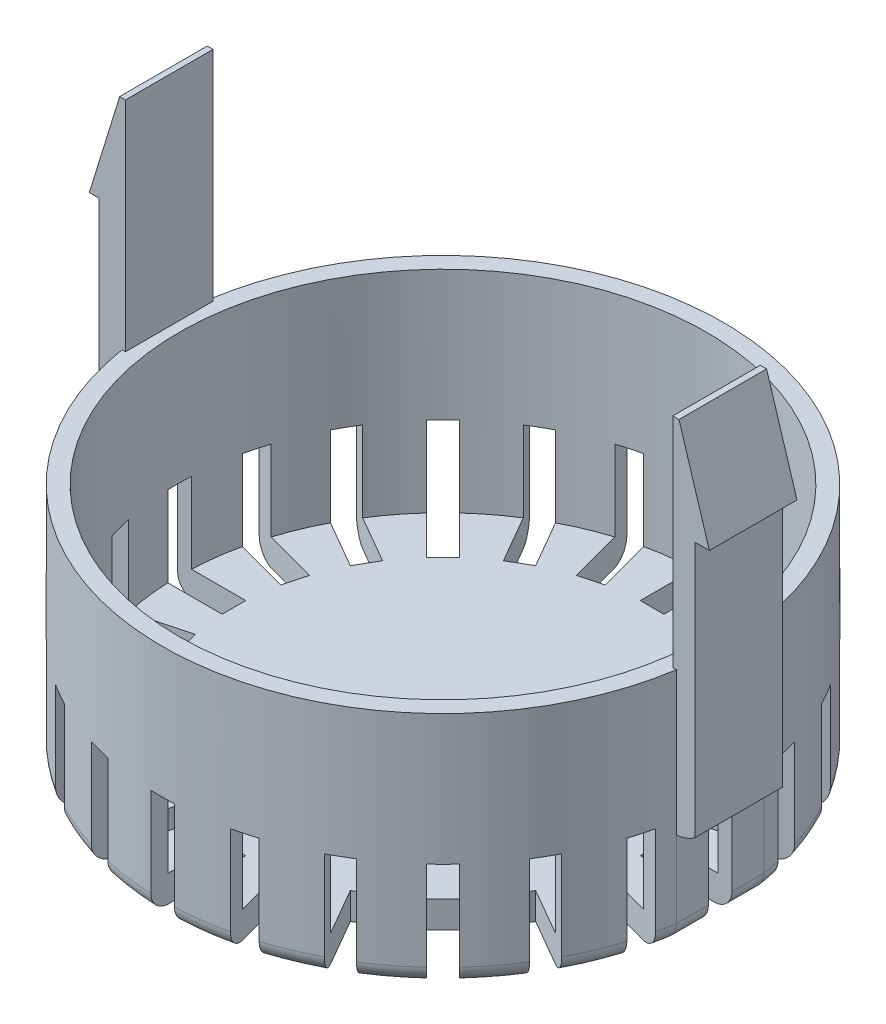
from build123d import *

# Parameters (mm, degrees)
SKETCH1_R           = 31.39
BOSS_EXTRUDE1_DEPTH = 26.6
SKETCH2_R           = 29.5
CUT_EXTRUDE1_DEPTH  = 23.6
BOSS_EXTRUDE2_DEPTH = 51
SKETCH5_W           = 3.660746386
SKETCH5_H           = 9.79976352
CUT_EXTRUDE2_DEPTH  = 10.6
SKETCH6_W           = 3.694805274
SKETCH6_H           = 9.8
CUT_EXTRUDE3_DEPTH  = 10.6
SKETCH7_W           = 2.64
SKETCH7_H           = 16
CUT_EXTRUDE4_DEPTH  = 12
CIRPATTERN1_COUNT   = 24
SKETCH8_W           = 2.64
SKETCH8_H           = 1.4
BOSS_EXTRUDE3_DEPTH = 2
SKETCH9_W           = 2.64
SKETCH9_H           = 1.4
BOSS_EXTRUDE4_DEPTH = 3.660746386
FILLET1_START       = -6
FILLET1_DEPTH       = 12
CUT_EXTRUDE6_DEPTH  = 72.568527301
CUT_EXTRUDE7_DEPTH  = 72.568527301
CUT_EXTRUDE8_DEPTH  = 72.568467345
CUT_EXTRUDE9_DEPTH  = 72.568467345
FILLET2_R           = 2
FILLET3_R           = 2


with BuildPart() as part:
    # Sketch1 → Boss-Extrude1 (new body)
    with BuildSketch(Plane(origin=(0, 0, 0), x_dir=(1, 0, 0), z_dir=(0, 1, 0))):
        with Locations(Location((0, 0, 0), (0, 0, 270))):
            Circle(SKETCH1_R)
    extrude(amount=BOSS_EXTRUDE1_DEPTH)

    # Sketch2 → Cut-Extrude1 (cut)
    with BuildSketch(Plane(origin=(0, 26.6, 0), x_dir=(1, 0, 0), z_dir=(0, 1, 0))):
        with Locations(Location((0, 0, 0), (0, 0, 270))):
            Circle(SKETCH2_R)
    extrude(amount=-CUT_EXTRUDE1_DEPTH, mode=Mode.SUBTRACT)

    # Sketch4 → Boss-Extrude2 (add)
    with BuildSketch(Plane.XZ):
        Polygon((-31.334040202, 4.89988176), (-34.665959798, 4.89988176), (-34.665959798, -4.89988176), (-31.265959798, -4.89988176), (-30.620686589, -4.89988176), (-30.620686589, 4.89988176), align=None)
        Polygon((31.3, -4.9), (34.7, -4.9), (34.7, 4.9), (31.3, 4.9), (30.602692971, 4.9), (30.602692971, -4.9), align=None)
    extrude(amount=-BOSS_EXTRUDE2_DEPTH)

    # Sketch5 → Cut-Extrude2 (cut)
    with BuildSketch(Plane.XZ):
        with Locations((-32.835586605, 0)):
            Rectangle(SKETCH5_W, SKETCH5_H)
    extrude(amount=-CUT_EXTRUDE2_DEPTH, mode=Mode.SUBTRACT)

    # Sketch6 → Cut-Extrude3 (cut)
    with BuildSketch(Plane.XZ):
        with Locations((32.852597363, 0)):
            Rectangle(SKETCH6_W, SKETCH6_H)
    extrude(amount=-CUT_EXTRUDE3_DEPTH, mode=Mode.SUBTRACT)

    # Sketch7 → Cut-Extrude4 (cut)
    with BuildSketch(Plane.XZ):
        with Locations((-5.9854e-05, 31.39)):
            Rectangle(SKETCH7_W, SKETCH7_H)
    cut_extrude4 = extrude(amount=-CUT_EXTRUDE4_DEPTH, mode=Mode.SUBTRACT)

    # CirPattern1: Cut-Extrude4 ×24 about axis
    cirpattern1_axis = Axis((0, 0, 0), (0, 1, 0))
    for i in range(1, CIRPATTERN1_COUNT):
        add(cut_extrude4.rotate(cirpattern1_axis, i * 360 / CIRPATTERN1_COUNT), mode=Mode.SUBTRACT)

    # Sketch8 → Boss-Extrude3 (add)
    with BuildSketch(Plane(origin=(34.7, 0, 0), x_dir=(0, 0, -1), z_dir=(1, 0, 0))):
        with Locations((-5.9854e-05, 11.3)):
            Rectangle(SKETCH8_W, SKETCH8_H)
    extrude(amount=-BOSS_EXTRUDE3_DEPTH)

    # Sketch9 → Boss-Extrude4 (add)
    with BuildSketch(Plane.ZY.offset(34.665959798)):
        with Locations((-5.9854e-05, 11.3)):
            Rectangle(SKETCH9_W, SKETCH9_H)
    extrude(amount=-BOSS_EXTRUDE4_DEPTH)

    # Fillet1: read off the stored shape, not the designer's step
    # Fillet1 outline → Fillet1 (cut)
    with BuildSketch(Plane.XY.offset(FILLET1_START)):
        with BuildLine():
            Line((31.005194726, 10.6), (34.7, 10.6))
            Line((34.7, 10.6), (34.7, 14.588340028))
            ThreePointArc((34.7, 14.588340028), (33.634346512, 11.869956216), (31.005194726, 10.6))
        make_face()
        with BuildLine():
            ThreePointArc((-31.005213412, 10.6), (-33.61189042, 11.879761698), (-34.665959798, 14.585587408))
            Line((-34.665959798, 14.585587408), (-34.665959798, 10.6))
            Line((-34.665959798, 10.6), (-31.005213412, 10.6))
        make_face()
    extrude(amount=FILLET1_DEPTH, mode=Mode.SUBTRACT)

    # Sketch11 → Cut-Extrude6 (cut, through all)
    with BuildSketch(Plane.XY.offset(4.9)):
        Polygon((34.7, 51), (34.7, 40), (31.3, 51), align=None)
    extrude(amount=-CUT_EXTRUDE6_DEPTH, mode=Mode.SUBTRACT)

    # Sketch12 → Cut-Extrude7 (cut, through all)
    with BuildSketch(Plane.XY.offset(4.9)):
        Polygon((33.09, 40), (38.082091957, 40), (37.618780389, 10.841923948), (33.09, 10.841923948), align=None)
    extrude(amount=-CUT_EXTRUDE7_DEPTH, mode=Mode.SUBTRACT)

    # Sketch13 → Cut-Extrude8 (cut, through all)
    with BuildSketch(Plane.XY.offset(4.89988176)):
        Polygon((-34.665959798, 40), (-31.265959798, 51), (-34.665959798, 51), align=None)
    extrude(amount=-CUT_EXTRUDE8_DEPTH, mode=Mode.SUBTRACT)

    # Sketch14 → Cut-Extrude9 (cut, through all)
    with BuildSketch(Plane.XY.offset(4.89988176)):
        with BuildLine():
            Line((-33.56, 40), (-34.665959798, 40))
            Line((-34.665959798, 40), (-34.665959798, 14.585587408))
            ThreePointArc((-34.665959798, 14.585587408), (-34.379190252, 13.098335043), (-33.56, 11.824332021))
            Line((-33.56, 11.824332021), (-33.56, 40))
        make_face()
    extrude(amount=-CUT_EXTRUDE9_DEPTH, mode=Mode.SUBTRACT)

    # Fillet2
    fillet2_edges = [part.edges().sort_by_distance(p)[0] for p in [
        (-4.097276568, 0, 31.121446379),
    ]]
    fillet(fillet2_edges, radius=FILLET2_R)

    # Fillet3
    fillet3_edges = [part.edges().sort_by_distance(p)[0] for p in [
        (31.005194726, 0, -3.109970073),
        (-31.005213412, 0, 3.109910953),
        (12.012377595, 0, 29.000601451),
        (19.108973729, 0, 24.903397821),
        (24.903324883, 0, 19.109068784),
        (29.0005556, 0, 12.012488288),
        (30.835501995, 0, 5.874003463),
        (-29.000601451, 0, 12.012377595),
        (-24.903397821, 0, 19.108973729),
        (-19.109068784, 0, 24.903324883),
        (-12.012488288, 0, 29.0005556),
        (29.000601451, 0, -12.012377595),
        (24.903397821, 0, -19.108973729),
        (19.109068784, 0, -24.903324883),
        (12.012488288, 0, -29.0005556),
        (4.097276568, 0, -31.121446379),
        (-4.09715778, 0, -31.121462018),
        (-12.012377595, 0, -29.000601451),
        (-19.108973729, 0, -24.903397821),
        (-24.903324883, 0, -19.109068784),
        (-29.0005556, 0, -12.012488288),
        (-30.835513196, 0, -5.873944667),
        (30.835513206, 0, -5.873944615),
        (-31.005213412, 0, -3.109970807),
        (31.005194726, 0, 3.110029927),
        (4.09715778, 0, 31.121462018),
        (-30.835524406, 0, 5.873885819),
    ]]
    fillet(fillet3_edges, radius=FILLET3_R)


solid = part.part
